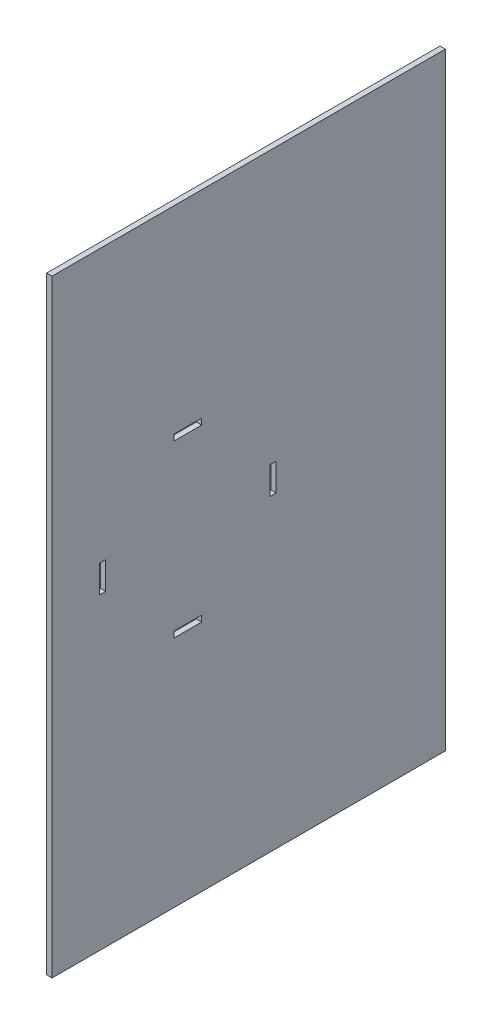
from build123d import *

# Parameters (mm, degrees)
SKETCH1_W           = 110
SKETCH1_H           = 170
SKETCH1_W_2         = 7.7
SKETCH1_H_2         = 1.7
SKETCH1_W_3         = 1.7
SKETCH1_H_3         = 7.7
BOSS_EXTRUDE1_DEPTH = 1.5


with BuildPart() as part:
    # Sketch1 → Boss-Extrude1 (new body)
    with BuildSketch(Plane(origin=(0, 0, 0), x_dir=(0, 0, -1), z_dir=(1, 0, 0))):
        with Locations((55, 85)):
            Rectangle(SKETCH1_W, SKETCH1_H)
        with Locations((38, 113.85042235)):
            Rectangle(SKETCH1_W_2, SKETCH1_H_2, mode=Mode.SUBTRACT)
        with Locations((61.85042235, 90)):
            Rectangle(SKETCH1_W_3, SKETCH1_H_3, mode=Mode.SUBTRACT)
        with Locations((38, 66.14957765)):
            Rectangle(SKETCH1_W_2, SKETCH1_H_2, mode=Mode.SUBTRACT)
        with Locations((14.14957765, 90)):
            Rectangle(SKETCH1_W_3, SKETCH1_H_3, mode=Mode.SUBTRACT)
    extrude(amount=BOSS_EXTRUDE1_DEPTH)


solid = part.part
